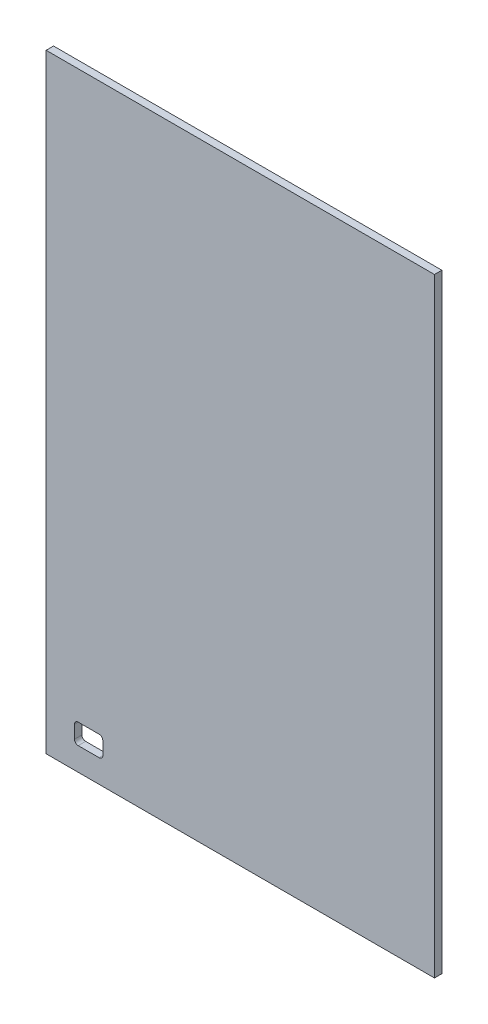
from build123d import *

# Parameters (mm, degrees)
SKETCH1_W           = 420
SKETCH1_H           = 658.95
BOSS_EXTRUDE1_DEPTH = 8


with BuildPart() as part:
    # Sketch1 → Boss-Extrude1 (new body)
    with BuildSketch(Plane.XY):
        with Locations((210, 329.475)):
            Rectangle(SKETCH1_W, SKETCH1_H)
        with BuildLine():
            Line((61.3, 43), (61.3, 29))
            ThreePointArc((61.3, 29), (61.12365555, 27.825411462), (60.610170883, 26.754389009))
            ThreePointArc((60.610170883, 26.754389009), (60.16106726, 26.204594102), (59.62184565, 25.742848978))
            ThreePointArc((59.62184565, 25.742848978), (58.518892102, 25.19023596), (57.3, 25))
            Line((57.3, 25), (34.7, 25))
            ThreePointArc((34.7, 25), (33.481107898, 25.19023596), (32.37815435, 25.742848978))
            ThreePointArc((32.37815435, 25.742848978), (31.83893274, 26.204594102), (31.389829117, 26.754389009))
            ThreePointArc((31.389829117, 26.754389009), (30.87634445, 27.825411462), (30.7, 29))
            Line((30.7, 29), (30.7, 43))
            ThreePointArc((30.7, 43), (30.87634445, 44.174588538), (31.389829117, 45.245610991))
            ThreePointArc((31.389829117, 45.245610991), (31.83893274, 45.795405898), (32.37815435, 46.257151022))
            ThreePointArc((32.37815435, 46.257151022), (33.481107898, 46.80976404), (34.7, 47))
            Line((34.7, 47), (57.3, 47))
            ThreePointArc((57.3, 47), (58.518892102, 46.80976404), (59.62184565, 46.257151022))
            ThreePointArc((59.62184565, 46.257151022), (60.16106726, 45.795405898), (60.610170883, 45.245610991))
            ThreePointArc((60.610170883, 45.245610991), (61.12365555, 44.174588538), (61.3, 43))
        make_face(mode=Mode.SUBTRACT)
    extrude(amount=BOSS_EXTRUDE1_DEPTH)


solid = part.part
